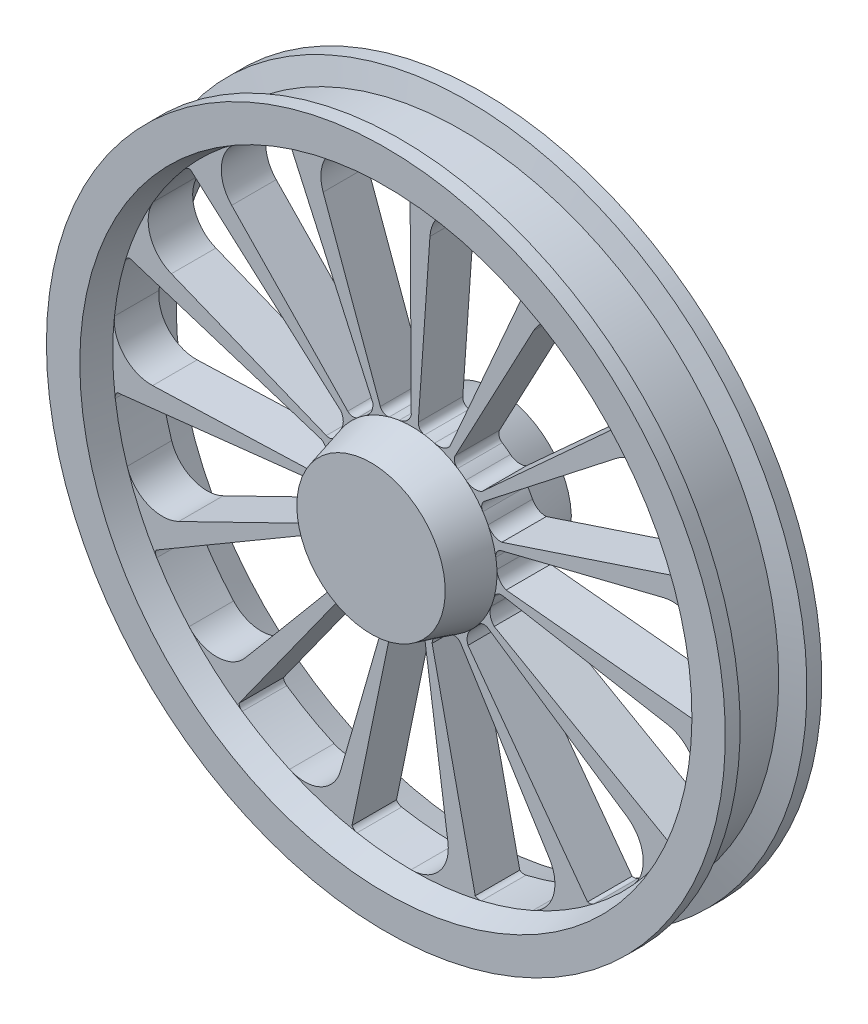
from build123d import *

# Parameters (mm, degrees)
CUT_EXTRUDE1_DEPTH = 100


with BuildPart() as part:
    # Sketch3 → Revolve1 (revolve)
    with BuildSketch(Plane(origin=(0, 0, 0), x_dir=(0, 0, -1), z_dir=(1, 0, 0))):
        Polygon((-85, -159.783995886), (-85, -259.783995886), (85, -259.783995886), (85, -159.783995886), (30, -145.046790303), (30, 143.337782379), (65, 152.716004114), (65, 197.716004114), (45, 197.716004114), (36.961524227, 167.716004114), (-36.961524227, 167.716004114), (-45, 197.716004114), (-65, 197.716004114), (-65, 152.716004114), (-30, 143.337782379), (-30, -145.046790303), align=None)
    revolve(axis=Axis((0, -259.783995886, -85), (0, 0, 1)))

    # Sketch4 → Cut-Extrude1 (cut)
    with BuildSketch(Plane(origin=(0, 0, -30), x_dir=(-1, 0, 0), z_dir=(0, 0, -1))):
        with BuildLine():
            ThreePointArc((10.254374104, 143.207338913), (5.963384615, 142.359658647), (2.444646176, 139.761653175))
            Line((2.444646176, 139.761653175), (0.781394375, -132.075239629))
            ThreePointArc((0.781394375, -132.075239629), (6.817333306, -141.57995103), (17.031258009, -146.317866157))
            ThreePointArc((17.031258009, -146.317866157), (23.794589812, -147.541206181), (30.472538424, -149.167312031))
            ThreePointArc((30.472538424, -149.167312031), (37.714753572, -148.412681157), (42.525319659, -142.946640367))
            Line((42.525319659, -142.946640367), (119.557929474, 68.69871566))
            ThreePointArc((119.557929474, 68.69871566), (116.274613155, 110.093653997), (82.849257452, 134.732377223))
            ThreePointArc((82.849257452, 134.732377223), (46.744280892, 140.618477027), (10.254374104, 143.207338913))
        make_face()
        with BuildLine():
            ThreePointArc((-24.384352007, 88.928484048), (-44.220648976, 125.409196878), (-84.777702422, 134.322473591))
            ThreePointArc((-84.777702422, 134.322473591), (-120.155332232, 125.014476366), (-154.543505821, 112.537737189))
            ThreePointArc((-154.543505821, 112.537737189), (-158.118737152, 110.018040072), (-160.276560645, 106.213444114))
            Line((-160.276560645, 106.213444114), (-51.22999153, -142.798419982))
            ThreePointArc((-51.22999153, -142.798419982), (-41.849972528, -149.026368369), (-30.592004317, -149.200291766))
            ThreePointArc((-30.592004317, -149.200291766), (-23.915816055, -147.566973614), (-17.153809599, -146.336328826))
            ThreePointArc((-17.153809599, -146.336328826), (-10.844652876, -142.701264941), (-8.67322116, -135.751154705))
            Line((-8.67322116, -135.751154705), (-24.384352007, 88.928484048))
        make_face()
        with BuildLine():
            ThreePointArc((52.657670093, -143.434063431), (54.305860278, -154.572086896), (61.709661101, -163.054765185))
            ThreePointArc((61.709661101, -163.054765185), (67.390694934, -166.923236782), (72.82990772, -171.124924796))
            ThreePointArc((72.82990772, -171.124924796), (79.7529365, -173.381209466), (86.370846379, -170.344366233))
            Line((86.370846379, -170.344366233), (242.827558799, -8.328697726))
            ThreePointArc((242.827558799, -8.328697726), (256.664938349, 30.822905219), (236.150828051, 66.926815876))
            ThreePointArc((236.150828051, 66.926815876), (205.561383192, 86.98925258), (173.279179588, 104.196077789))
            ThreePointArc((173.279179588, 104.196077789), (169.014383006, 105.166985993), (164.743151465, 104.224789756))
            Line((164.743151465, 104.224789756), (52.657670093, -143.434063431))
        make_face()
        with BuildLine():
            ThreePointArc((-72.925631177, -171.203644439), (-67.490960057, -166.996083658), (-61.814108105, -163.121477896))
            ThreePointArc((-61.814108105, -163.121477896), (-57.528920322, -157.234516569), (-58.372083247, -150.002074086))
            Line((-58.372083247, -150.002074086), (-164.110357501, 48.862696703))
            ThreePointArc((-164.110357501, 48.862696703), (-197.069759166, 74.121337359), (-237.745827367, 65.767981041))
            ThreePointArc((-237.745827367, 65.767981041), (-266.278996837, 42.875324068), (-292.619409606, 17.490325379))
            ThreePointArc((-292.619409606, 17.490325379), (-294.860692802, 13.734289934), (-295.284494064, 9.380952694))
            Line((-295.284494064, 9.380952694), (-94.383246489, -173.749469189))
            ThreePointArc((-94.383246489, -173.749469189), (-83.281037917, -175.623785707), (-72.925631177, -171.203644439))
        make_face()
        with BuildLine():
            ThreePointArc((95.428956272, -174.910847561), (92.404410655, -185.756317647), (95.717903174, -196.51702696))
            ThreePointArc((95.717903174, -196.51702696), (99.334336676, -202.361736245), (102.594324332, -208.412496394))
            ThreePointArc((102.594324332, -208.412496394), (108.001112174, -213.289564492), (115.282069106, -213.207016599))
            Line((115.282069106, -213.207016599), (324.110097188, -128.835016564))
            ThreePointArc((324.110097188, -128.835016564), (352.675563975, -98.696416841), (348.619775118, -57.3700129))
            ThreePointArc((348.619775118, -57.3700129), (328.835054871, -26.600216864), (306.34244073, 2.249355272))
            ThreePointArc((306.34244073, 2.249355272), (302.841259128, 4.870973096), (298.55606922, 5.747500383))
            Line((298.55606922, 5.747500383), (95.428956272, -174.910847561))
        make_face()
        with BuildLine():
            ThreePointArc((-102.649753898, -208.523344604), (-99.39630393, -202.469066678), (-95.786185757, -196.620454477))
            ThreePointArc((-95.786185757, -196.620454477), (-94.265914809, -189.499504804), (-97.977881847, -183.235285084))
            Line((-97.977881847, -183.235285084), (-275.460191287, -44.570907759))
            ThreePointArc((-275.460191287, -44.570907759), (-315.843717675, -34.901787712), (-349.605538906, -59.077405866))
            ThreePointArc((-349.605538906, -59.077405866), (-366.36060382, -91.596374224), (-380.098759106, -125.500335536))
            ThreePointArc((-380.098759106, -125.500335536), (-380.618555941, -129.843256659), (-379.235055884, -133.992603622))
            Line((-379.235055884, -133.992603622), (-121.216780685, -219.576669661))
            ThreePointArc((-121.216780685, -219.576669661), (-110.312055265, -216.773267957), (-102.649753898, -208.523344604))
        make_face()
        with BuildLine():
            ThreePointArc((121.699708967, -221.062970084), (114.525398961, -229.740606486), (113.175650218, -240.918722424))
            ThreePointArc((113.175650218, -240.918722424), (114.102169183, -247.729066065), (114.619250226, -254.58266695))
            ThreePointArc((114.619250226, -254.58266695), (117.574914394, -261.237229094), (124.259974779, -264.123249823))
            Line((124.259974779, -264.123249823), (349.351055326, -271.983603561))
            ThreePointArc((349.351055326, -271.983603561), (387.705380633, -256.069244753), (400.809195955, -216.666058207))
            ThreePointArc((400.809195955, -216.666058207), (395.250158191, -180.509280108), (386.436310836, -145.005314159))
            ThreePointArc((386.436310836, -145.005314159), (384.30413032, -141.186288252), (380.745930311, -138.642596973))
            Line((380.745930311, -138.642596973), (121.699708967, -221.062970084))
        make_face()
        with BuildLine():
            ThreePointArc((-114.624801626, -254.706477064), (-114.115123866, -247.852321647), (-113.1959617, -241.040981191))
            ThreePointArc((-113.1959617, -241.040981191), (-114.703476248, -233.917320061), (-120.642414575, -229.704463602))
            Line((-120.642414575, -229.704463602), (-339.180455522, -175.216810307))
            ThreePointArc((-339.180455522, -175.216810307), (-380.005428047, -182.809089568), (-401.015276703, -218.62678555))
            ThreePointArc((-401.015276703, -218.62678555), (-403.09513412, -255.149240238), (-401.855580068, -291.709861254))
            ThreePointArc((-401.855580068, -291.709861254), (-400.564012946, -295.888737538), (-397.612431299, -299.11663444))
            Line((-397.612431299, -299.11663444), (-127.090832281, -272.356082109))
            ThreePointArc((-127.090832281, -272.356082109), (-118.269116105, -265.359695806), (-114.624801626, -254.706477064))
        make_face()
        with BuildLine():
            ThreePointArc((126.927476375, -273.910309738), (116.843905357, -278.919670288), (111.064299172, -288.582395055))
            ThreePointArc((111.064299172, -288.582395055), (109.140700052, -295.180802767), (106.825466474, -301.652194532))
            ThreePointArc((106.825466474, -301.652194532), (106.818945781, -308.933616473), (111.752201947, -314.28918662))
            Line((111.752201947, -314.28918662), (314.186042243, -413.022767561))
            ThreePointArc((314.186042243, -413.022767561), (355.697414787, -414.084386883), (383.695065574, -383.417586653))
            ThreePointArc((383.695065574, -383.417586653), (393.322918424, -348.125661899), (399.711832135, -312.106260392))
            ThreePointArc((399.711832135, -312.106260392), (399.317326087, -307.750170677), (397.101361083, -303.979142736))
            Line((397.101361083, -303.979142736), (126.927476375, -273.910309738))
        make_face()
        with BuildLine():
            ThreePointArc((-106.780179819, -301.767558657), (-109.102402183, -295.298671489), (-111.033127513, -288.702345421))
            ThreePointArc((-111.033127513, -288.702345421), (-115.307764594, -282.80771856), (-122.44677782, -281.374666517))
            Line((-122.44677782, -281.374666517), (-344.25333764, -320.485147511))
            ThreePointArc((-344.25333764, -320.485147511), (-378.460747669, -344.026052021), (-383.085830047, -385.292620802))
            ThreePointArc((-383.085830047, -385.292620802), (-370.130853727, -419.503497609), (-354.127920493, -452.399114812))
            ThreePointArc((-354.127920493, -452.399114812), (-351.248313104, -455.691380584), (-347.239005147, -457.439694726))
            Line((-347.239005147, -457.439694726), (-110.989724392, -322.961666636))
            ThreePointArc((-110.989724392, -322.961666636), (-105.776372329, -312.982034486), (-106.780179819, -301.767558657))
        make_face()
        with BuildLine():
            ThreePointArc((110.208330017, -324.315081394), (98.959039023, -324.790002144), (89.748921811, -331.266562845))
            ThreePointArc((89.748921811, -331.266562845), (85.30781237, -336.512109989), (80.560589089, -341.482330207))
            ThreePointArc((80.560589089, -341.482330207), (77.593011023, -348.131587942), (79.921458161, -355.030680775))
            Line((79.921458161, -355.030680775), (224.695408166, -527.565555808))
            ThreePointArc((224.695408166, -527.565555808), (262.186134514, -545.419589635), (300.236572595, -528.791744079))
            ThreePointArc((300.236572595, -528.791744079), (323.386572835, -500.466967078), (343.873546389, -470.16021176))
            ThreePointArc((343.873546389, -470.16021176), (345.284928489, -466.020265722), (344.794358971, -461.673946109))
            Line((344.794358971, -461.673946109), (110.208330017, -324.315081394))
        make_face()
        with BuildLine():
            ThreePointArc((-80.472294854, -341.569300838), (-85.224883997, -336.604211278), (-89.671656875, -331.363464301))
            ThreePointArc((-89.671656875, -331.363464301), (-95.974292905, -327.717106245), (-103.078980787, -329.311646334))
            Line((-103.078980787, -329.311646334), (-289.801690237, -455.257704146))
            ThreePointArc((-289.801690237, -455.257704146), (-311.476765811, -490.676797653), (-298.917363152, -530.256874597))
            ThreePointArc((-298.917363152, -530.256874597), (-273.167586192, -556.240802126), (-245.168326313, -579.783464455))
            ThreePointArc((-245.168326313, -579.783464455), (-241.198588935, -581.619857053), (-236.824800438, -581.586289037))
            Line((-236.824800438, -581.586289037), (-75.697484845, -362.643257939))
            ThreePointArc((-75.697484845, -362.643257939), (-74.993932829, -351.405949002), (-80.472294854, -341.569300838))
        make_face()
        with BuildLine():
            ThreePointArc((74.433162188, -363.561842118), (63.963255827, -359.420204956), (52.915140525, -361.590745409))
            ThreePointArc((52.915140525, -361.590745409), (46.724428933, -364.57642923), (40.366053981, -367.186081672))
            ThreePointArc((40.366053981, -367.186081672), (34.950539748, -372.053458132), (34.271568195, -379.303157824))
            Line((34.271568195, -379.303157824), (96.352896723, -595.806479625))
            ThreePointArc((96.352896723, -595.806479625), (123.340489698, -627.36580331), (164.864448651, -627.652017985))
            ThreePointArc((164.864448651, -627.652017985), (197.533750928, -611.192000001), (228.57640048, -591.838204194))
            ThreePointArc((228.57640048, -591.838204194), (231.54962994, -588.630236114), (232.869279835, -584.460142975))
            Line((232.869279835, -584.460142975), (74.433162188, -363.561842118))
        make_face()
        with BuildLine():
            ThreePointArc((-40.250019041, -367.229620796), (-46.611209125, -364.626837936), (-52.805142121, -361.647842813))
            ThreePointArc((-52.805142121, -361.647842813), (-60.045994073, -360.880241995), (-65.887891532, -365.22666375))
            Line((-65.887891532, -365.22666375), (-185.240697826, -556.2310808))
            ThreePointArc((-185.240697826, -556.2310808), (-190.635621467, -597.404080265), (-163.063368588, -628.453910493))
            ThreePointArc((-163.063368588, -628.453910493), (-128.971161354, -641.718031618), (-93.81690123, -651.836998878))
            ThreePointArc((-93.81690123, -651.836998878), (-89.443437519, -651.89998934), (-85.461436247, -650.09034338))
            Line((-85.461436247, -650.09034338), (-27.316462478, -384.539548386))
            ThreePointArc((-27.316462478, -384.539548386), (-31.244361044, -373.987595465), (-40.250019041, -367.229620796))
        make_face()
        with BuildLine():
            ThreePointArc((25.787824413, -384.864470437), (17.907644611, -376.822402054), (6.931850724, -374.311616095))
            ThreePointArc((6.931850724, -374.311616095), (0.061967254, -374.521184736), (-6.808138575, -374.319036788))
            ThreePointArc((-6.808138575, -374.319036788), (-13.735197365, -376.562918363), (-17.304187259, -382.909685976))
            Line((-17.304187259, -382.909685976), (-48.649905902, -605.946063336))
            ThreePointArc((-48.649905902, -605.946063336), (-36.8318463, -645.753783105), (0.985763789, -662.904568893))
            ThreePointArc((0.985763789, -662.904568893), (37.525548948, -661.155396571), (73.756318376, -656.101007395))
            ThreePointArc((73.756318376, -656.101007395), (77.777296813, -654.379704096), (80.678986664, -651.10688442))
            Line((80.678986664, -651.10688442), (25.787824413, -384.864470437))
        make_face()
    extrude(amount=-CUT_EXTRUDE1_DEPTH, mode=Mode.SUBTRACT)


solid = part.part
